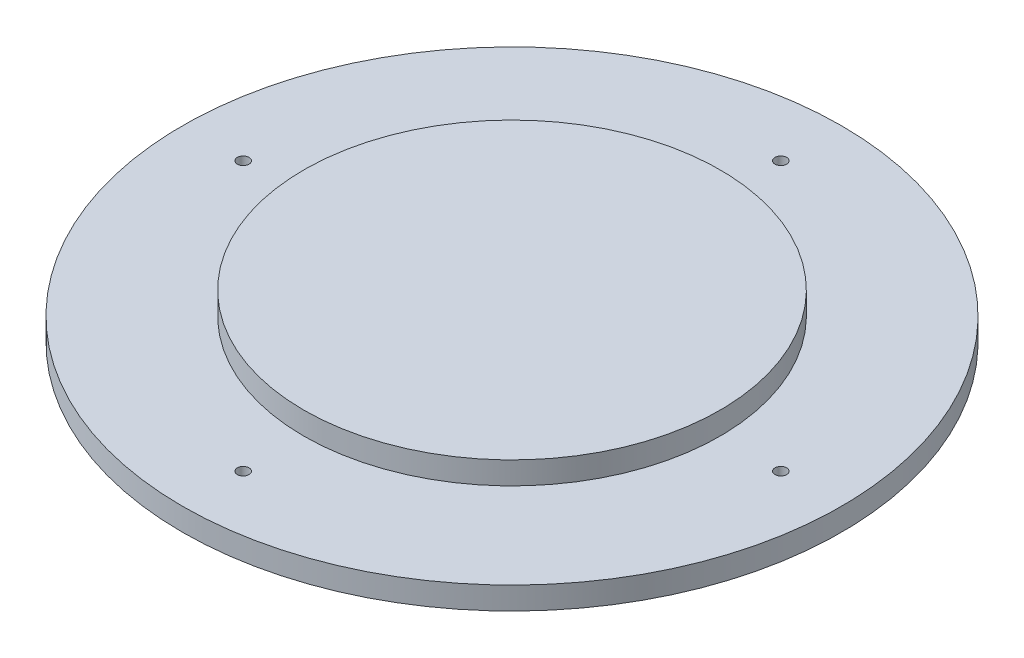
from build123d import *

# Parameters (mm, degrees)
ESQUISSE1_R             = 84.1225
BOSS_EXTRU_1_DEPTH      = 5.75
ESQUISSE2_R             = 53.13
BOSS_EXTRU_2_DEPTH      = 5.75
ESQUISSE3_R             = 1.5
ENL_V_MAT_EXTRU_1_DEPTH = 5


with BuildPart() as part:
    # Esquisse1 → Boss.-Extru.1 (new body)
    with BuildSketch(Plane(origin=(0, 0, 0), x_dir=(1, 0, 0), z_dir=(0, 1, 0))):
        Circle(ESQUISSE1_R)
    extrude(amount=-BOSS_EXTRU_1_DEPTH)

    # Esquisse2 → Boss.-Extru.2 (add)
    with BuildSketch(Plane(origin=(0, 0, 0), x_dir=(1, 0, 0), z_dir=(0, 1, 0))):
        Circle(ESQUISSE2_R)
    extrude(amount=BOSS_EXTRU_2_DEPTH)

    # Esquisse3 → Enlèv. mat.-Extru.1 (cut)
    with BuildSketch(Plane(origin=(0, 0, 0), x_dir=(1, 0, 0), z_dir=(0, 1, 0))):
        with Locations((-68.6225, 0)):
            Circle(ESQUISSE3_R)
        with Locations((0, -68.6225)):
            Circle(ESQUISSE3_R)
        with Locations((0, 68.6225)):
            Circle(ESQUISSE3_R)
        with Locations((68.6225, 0)):
            Circle(ESQUISSE3_R)
    extrude(amount=-ENL_V_MAT_EXTRU_1_DEPTH, mode=Mode.SUBTRACT)


solid = part.part
